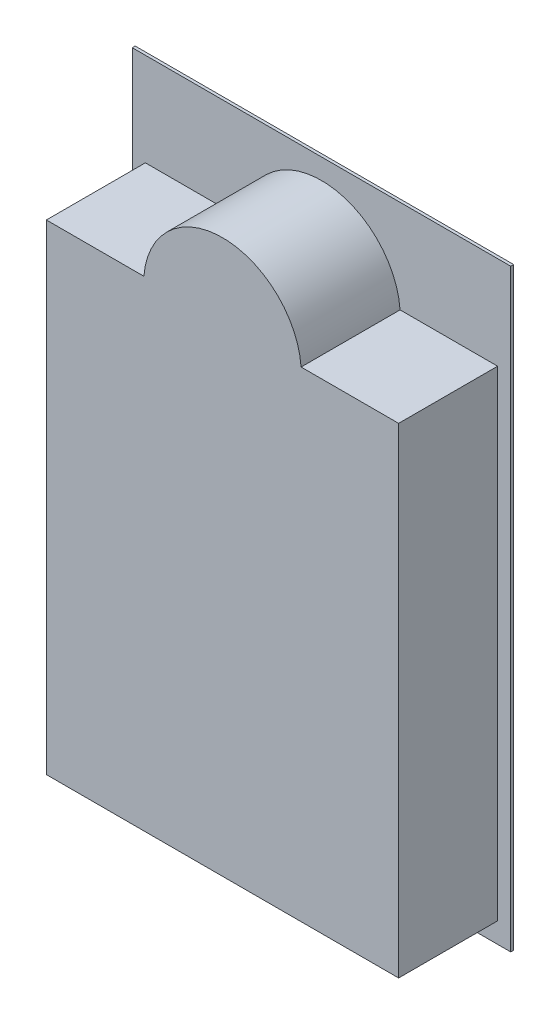
from build123d import *
from OCP.BRepFilletAPI import BRepFilletAPI_MakeChamfer

# Parameters (mm, degrees)
BOSS_EXTRUDE1_DEPTH = 17
SKETCH2_W           = 65
SKETCH2_H           = 102
BOSS_EXTRUDE2_DEPTH = 2.5
SHELL1_START        = -2.5
SHELL1_DEPTH        = 16.5
CHAMFER1_SIZE       = 2
CHAMFER1_SIZE2      = 3.464101615
SKETCH3_W           = 56.07179677
SKETCH3_H           = 93.07179677
BOSS_EXTRUDE3_DEPTH = 1
SKETCH5_R           = 7.637477526
BOSS_EXTRUDE4_DEPTH = 10
BOSS_EXTRUDE4_TAPER = 2
FILLET1_R           = 2


# Read off the part's stored shape, not the designer's step: Shell1
with BuildPart() as part:
    # Sketch1 → Boss-Extrude1 (new body)
    with BuildSketch(Plane.XY):
        with BuildLine():
            Line((13.5, 35), (30.25, 35))
            Line((30.25, 35), (30.25, -47.5))
            Line((30.25, -47.5), (-30.25, -47.5))
            Line((-30.25, -47.5), (-30.25, 35))
            Line((-30.25, 35), (-13.5, 35))
            ThreePointArc((-13.5, 35), (0, 47.5), (13.5, 35))
        make_face()
    extrude(amount=BOSS_EXTRUDE1_DEPTH)

    # Sketch2 → Boss-Extrude2 (add)
    with BuildSketch(Plane(origin=(0, 0, 0), x_dir=(-1, 0, 0), z_dir=(0, 0, -1))):
        Rectangle(SKETCH2_W, SKETCH2_H)
    extrude(amount=BOSS_EXTRUDE2_DEPTH)

    # Shell1 outline → Shell1 (cut)
    with BuildSketch(Plane.XY.offset(SHELL1_START)):
        with BuildLine():
            Line((27.25, -44.5), (27.25, 32))
            Line((27.25, 32), (10.356157589, 32))
            ThreePointArc((10.356157589, 32), (0, 44.5), (-10.356157589, 32))
            Line((-10.356157589, 32), (-27.25, 32))
            Line((-27.25, 32), (-27.25, -44.5))
            Line((-27.25, -44.5), (27.25, -44.5))
        make_face()
    extrude(amount=SHELL1_DEPTH, mode=Mode.SUBTRACT)

    # Chamfer1: one chamfer whose edges measure the first distance from different faces: ONE call of the kernel's chamfer builder (chamfer() names one face for all edges)
    chamfer1_edges_1 = [part.edges().sort_by_distance(p)[0] for p in [
        (0, -51, -2.5),
    ]]
    chamfer1_side_1 = [part.faces().sort_by_distance(p)[0] for p in [
        (0, -51, -1.25),
    ]]
    chamfer1_edges_2 = [part.edges().sort_by_distance(p)[0] for p in [
        (32.5, 0, -2.5),
    ]]
    chamfer1_side_2 = [part.faces().sort_by_distance(p)[0] for p in [
        (32.5, 0, -1.25),
    ]]
    chamfer1_edges_3 = [part.edges().sort_by_distance(p)[0] for p in [
        (0, 51, -2.5),
    ]]
    chamfer1_side_3 = [part.faces().sort_by_distance(p)[0] for p in [
        (0, 51, -1.25),
    ]]
    chamfer1_edges_4 = [part.edges().sort_by_distance(p)[0] for p in [
        (-32.5, 0, -2.5),
    ]]
    chamfer1_side_4 = [part.faces().sort_by_distance(p)[0] for p in [
        (-32.5, 0, -1.25),
    ]]
    chamfer1 = BRepFilletAPI_MakeChamfer(part.part.solid().wrapped)
    for e in chamfer1_edges_1:
        chamfer1.Add(CHAMFER1_SIZE, CHAMFER1_SIZE2, e.wrapped, chamfer1_side_1[0].wrapped)  # the first distance lies on this face
    for e in chamfer1_edges_2:
        chamfer1.Add(CHAMFER1_SIZE, CHAMFER1_SIZE2, e.wrapped, chamfer1_side_2[0].wrapped)  # the first distance lies on this face
    for e in chamfer1_edges_3:
        chamfer1.Add(CHAMFER1_SIZE, CHAMFER1_SIZE2, e.wrapped, chamfer1_side_3[0].wrapped)  # the first distance lies on this face
    for e in chamfer1_edges_4:
        chamfer1.Add(CHAMFER1_SIZE, CHAMFER1_SIZE2, e.wrapped, chamfer1_side_4[0].wrapped)  # the first distance lies on this face
    add(Compound.cast(chamfer1.Shape()), mode=Mode.REPLACE)

    # Sketch3 → Boss-Extrude3 (add)
    with BuildSketch(Plane(origin=(0, 0, -2.5), x_dir=(-1, 0, 0), z_dir=(0, 0, -1))):
        Rectangle(SKETCH3_W, SKETCH3_H)
    extrude(amount=BOSS_EXTRUDE3_DEPTH)

    # Sketch5 → Boss-Extrude4 (add)
    with BuildSketch(Plane(origin=(0, 0, -3.5), x_dir=(-1, 0, 0), z_dir=(0, 0, -1))):
        with Locations((18.314549778, 1.094735509)):
            Circle(SKETCH5_R)
    extrude(amount=BOSS_EXTRUDE4_DEPTH, taper=BOSS_EXTRUDE4_TAPER)

    # Fillet1
    fillet1_edges = [part.edges().sort_by_distance(p)[0] for p in [
        (-11.026279948, 1.094735509, -13.5),
    ]]
    fillet(fillet1_edges, radius=FILLET1_R)


solid = part.part
